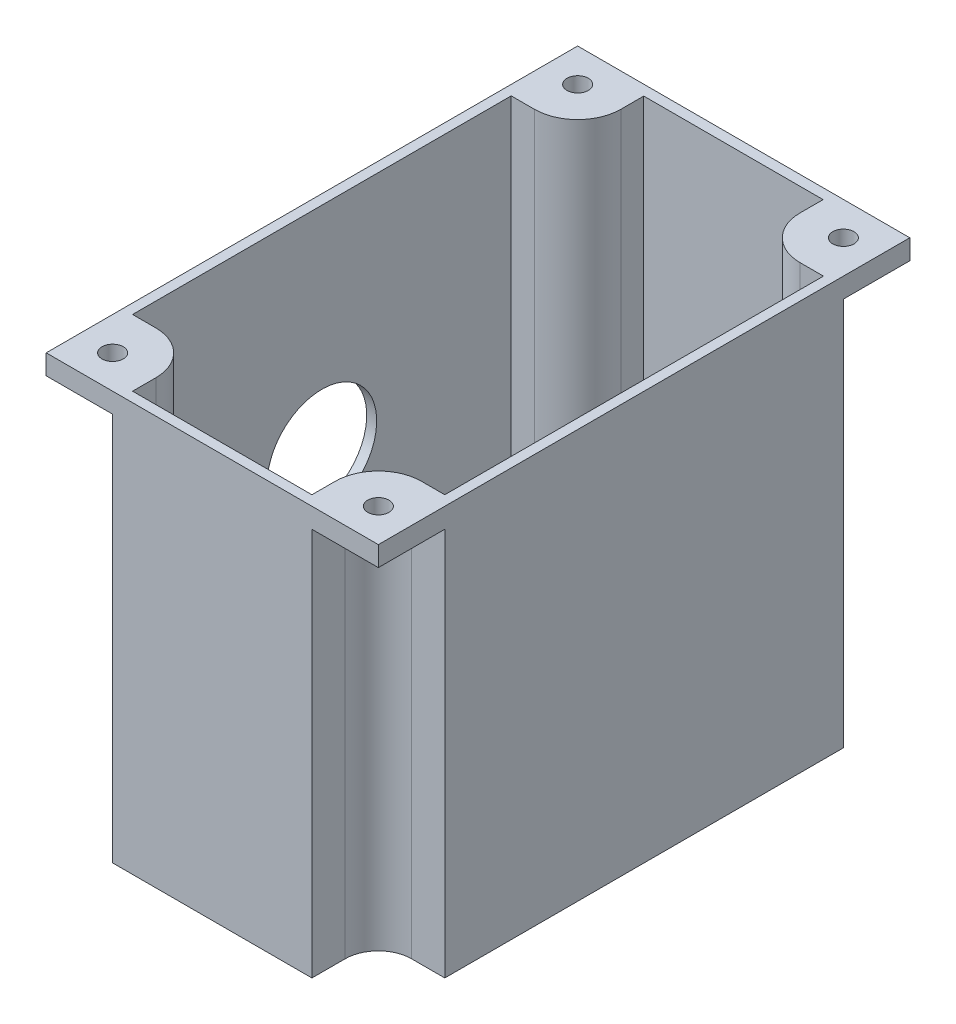
from build123d import *

# Parameters (mm, degrees)
BOSS_EXTRUDE6_DEPTH = 60
BOSS_EXTRUDE8_START = 1.5
BOSS_EXTRUDE8_DEPTH = 1.5
BOSS_EXTRUDE9_START = -3
BOSS_EXTRUDE9_DEPTH = 3
SKETCH15_R          = 1.6
CUT_EXTRUDE4_DEPTH  = 78.506451344
SKETCH11_R          = 8.25
CUT_EXTRUDE3_DEPTH  = 1.5


with BuildPart() as part:
    # Sketch1 → Boss-Extrude6 (new body)
    with BuildSketch(Plane(origin=(0, 0, 0), x_dir=(1, 0, 0), z_dir=(0, 1, 0))):
        with BuildLine():
            Line((-15, -35), (-15, -40))
            Line((-15, -40), (-13.5, -40))
            Line((-13.5, -40), (13.5, -40))
            Line((13.5, -40), (15, -40))
            Line((15, -40), (15, -35))
            ThreePointArc((15, -35), (16.464466094, -31.464466094), (20, -30))
            Line((20, -30), (25, -30))
            Line((25, -30), (25, -28.5))
            Line((25, -28.5), (25, 28.5))
            Line((25, 28.5), (25, 30))
            Line((25, 30), (20, 30))
            ThreePointArc((20, 30), (16.464466094, 31.464466094), (15, 35))
            Line((15, 35), (15, 40))
            Line((15, 40), (13.5, 40))
            Line((13.5, 40), (-13.5, 40))
            Line((-13.5, 40), (-15, 40))
            Line((-15, 40), (-15, 35))
            ThreePointArc((-15, 35), (-16.464466094, 31.464466094), (-20, 30))
            Line((-20, 30), (-25, 30))
            Line((-25, 30), (-25, 28.5))
            Line((-25, 28.5), (-25, -28.5))
            Line((-25, -28.5), (-25, -30))
            Line((-25, -30), (-20, -30))
            ThreePointArc((-20, -30), (-16.464466094, -31.464466094), (-15, -35))
        make_face()
        with BuildLine():
            Line((20, 28.5), (23.5, 28.5))
            Line((23.5, 28.5), (23.5, -28.5))
            Line((23.5, -28.5), (20, -28.5))
            ThreePointArc((20, -28.5), (15.403805922, -30.403805922), (13.5, -35))
            Line((13.5, -35), (13.5, -38.5))
            Line((13.5, -38.5), (-13.5, -38.5))
            Line((-13.5, -38.5), (-13.5, -35))
            ThreePointArc((-13.5, -35), (-15.403805922, -30.403805922), (-20, -28.5))
            Line((-20, -28.5), (-23.5, -28.5))
            Line((-23.5, -28.5), (-23.5, 28.5))
            Line((-23.5, 28.5), (-20, 28.5))
            ThreePointArc((-20, 28.5), (-15.403805922, 30.403805922), (-13.5, 35))
            Line((-13.5, 35), (-13.5, 38.45))
            Line((-13.5, 38.45), (13.5, 38.45))
            Line((13.5, 38.45), (13.5, 35))
            ThreePointArc((13.5, 35), (15.403805922, 30.403805922), (20, 28.5))
        make_face(mode=Mode.SUBTRACT)
    extrude(amount=BOSS_EXTRUDE6_DEPTH)

    # Sketch7 → Boss-Extrude8 (add)
    with BuildSketch(Plane.XZ.offset(BOSS_EXTRUDE8_START)):
        with BuildLine():
            Line((-15, 40), (15, 40))
            Line((15, 40), (15, 35))
            ThreePointArc((15, 35), (16.464466094, 31.464466094), (20, 30))
            Line((20, 30), (25, 30))
            Line((25, 30), (25, -30))
            Line((25, -30), (20, -30))
            ThreePointArc((20, -30), (16.464466094, -31.464466094), (15, -35))
            Line((15, -35), (15, -40))
            Line((15, -40), (-15, -40))
            Line((-15, -40), (-15, -35))
            ThreePointArc((-15, -35), (-16.464466094, -31.464466094), (-20, -30))
            Line((-20, -30), (-25, -30))
            Line((-25, -30), (-25, 30))
            Line((-25, 30), (-20, 30))
            ThreePointArc((-20, 30), (-16.464466094, 31.464466094), (-15, 35))
            Line((-15, 35), (-15, 40))
        make_face()
    extrude(amount=-BOSS_EXTRUDE8_DEPTH)

    # Sketch12 → Boss-Extrude9 (add)
    with BuildSketch(Plane(origin=(0, 60, 0), x_dir=(1, 0, 0), z_dir=(0, 1, 0)).offset(BOSS_EXTRUDE9_START)):
        with BuildLine():
            Line((-25, 40), (-15, 40))
            Line((-15, 40), (-15, 35))
            ThreePointArc((-15, 35), (-16.464466094, 31.464466094), (-20, 30))
            Line((-20, 30), (-25, 30))
            Line((-25, 30), (-25, 40))
        make_face()
        with BuildLine():
            Line((15, 40), (25, 40))
            Line((25, 40), (25, 30))
            Line((25, 30), (20, 30))
            ThreePointArc((20, 30), (16.464466094, 31.464466094), (15, 35))
            Line((15, 35), (15, 40))
        make_face()
        with BuildLine():
            Line((20, -30), (25, -30))
            Line((25, -30), (25, -40))
            Line((25, -40), (15, -40))
            Line((15, -40), (15, -35))
            ThreePointArc((15, -35), (16.464466094, -31.464466094), (20, -30))
        make_face()
        with BuildLine():
            Line((-15, -40), (-25, -40))
            Line((-25, -40), (-25, -30))
            Line((-25, -30), (-20, -30))
            ThreePointArc((-20, -30), (-16.464466094, -31.464466094), (-15, -35))
            Line((-15, -35), (-15, -40))
        make_face()
    extrude(amount=BOSS_EXTRUDE9_DEPTH)

    # Sketch15 → Cut-Extrude4 (cut, through all)
    with BuildSketch(Plane(origin=(0, 60, 0), x_dir=(1, 0, 0), z_dir=(0, 1, 0))):
        with Locations((-20, -35)):
            Circle(SKETCH15_R)
        with Locations((20, -35)):
            Circle(SKETCH15_R)
        with Locations((20, 35)):
            Circle(SKETCH15_R)
        with Locations((-20, 35)):
            Circle(SKETCH15_R)
    extrude(amount=-CUT_EXTRUDE4_DEPTH, mode=Mode.SUBTRACT)

    # Sketch11 → Cut-Extrude3 (cut)
    with BuildSketch(Plane.ZY.offset(25)):
        with Locations((0, 27.75)):
            Circle(SKETCH11_R)
    extrude(amount=-CUT_EXTRUDE3_DEPTH, mode=Mode.SUBTRACT)


solid = part.part
